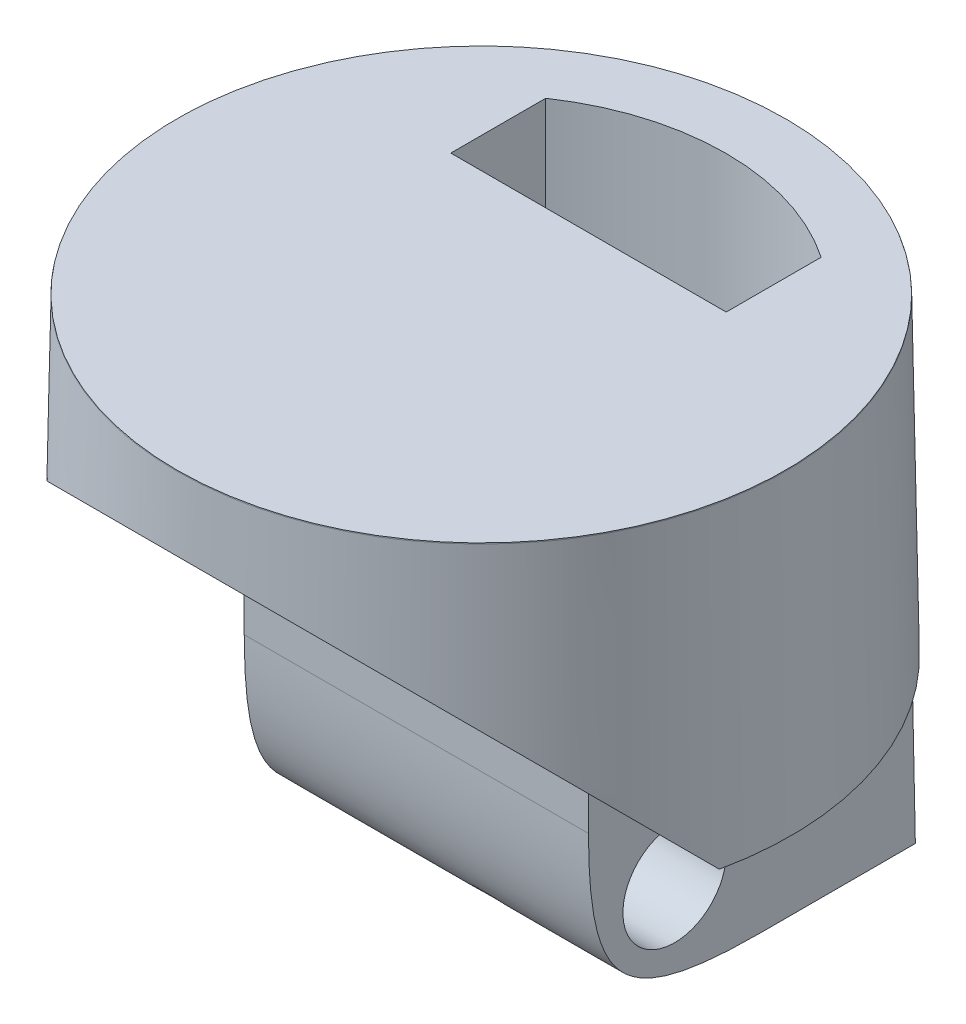
from build123d import *

# Parameters (mm, degrees)
SKETCH1_R                     = 9
BOSS_EXTRUDE1_DEPTH           = 19
BOSS_EXTRUDE1_TAPER           = 1
BOSS_EXTRUDE1_OTHER_WAY_DEPTH = 6
BOSS_EXTRUDE1_OTHER_WAY_TAPER = -1
CUT_EXTRUDE1_DEPTH            = 23.951954839
CUT_EXTRUDE1_DEPTH_BACK       = 23.951954839
SKETCH4_W                     = 6.502745185
SKETCH4_H                     = 6
CUT_EXTRUDE2_DEPTH            = 24.763281499
SKETCH5_R                     = 1.5
CUT_EXTRUDE3_DEPTH            = 26.296168166
FILLET1_SIZE                  = 5
CUT_EXTRUDE4_DEPTH            = 23.910611578
CUT_EXTRUDE4_DEPTH_BACK       = 23.910611578
SKETCH6_W                     = 24.694280634
SKETCH6_H                     = 10.883453579
CUT_EXTRUDE5_DEPTH            = 20.809242737


with BuildPart() as part:
    # Sketch1 → Boss-Extrude1 (new body)
    with BuildSketch(Plane(origin=(0, 0, 0), x_dir=(1, 0, 0), z_dir=(0, 1, 0))):
        Circle(SKETCH1_R)
    extrude(amount=BOSS_EXTRUDE1_DEPTH, taper=BOSS_EXTRUDE1_TAPER)

    # Sketch1 → Boss-Extrude1 other way (add)
    with BuildSketch(Plane(origin=(0, 0, 0), x_dir=(1, 0, 0), z_dir=(0, 1, 0))):
        Circle(SKETCH1_R)
    extrude(amount=-BOSS_EXTRUDE1_OTHER_WAY_DEPTH, taper=BOSS_EXTRUDE1_OTHER_WAY_TAPER)

    # Sketch3 → Cut-Extrude1 (cut, two sides: drawn at the far end of the back side and taken through both)
    with BuildSketch(Plane(origin=(0, 0, 0), x_dir=(0, 0, -1), z_dir=(1, 0, 0)).offset(-CUT_EXTRUDE1_DEPTH_BACK)):
        Polygon((-1.886057768, -6), (-1.886057768, 0), (-9.929766736, 8.043708969), (-9.929766736, -6), align=None)
    extrude(amount=CUT_EXTRUDE1_DEPTH + CUT_EXTRUDE1_DEPTH_BACK, mode=Mode.SUBTRACT)

    # Sketch4 → Cut-Extrude2 (cut, through all)
    with BuildSketch(Plane.XY.offset(1.886057768)):
        with Locations((-8.251372593, -3)):
            Rectangle(SKETCH4_W, SKETCH4_H)
        with Locations((8.251372593, -3)):
            Rectangle(SKETCH4_W, SKETCH4_H)
    extrude(amount=-CUT_EXTRUDE2_DEPTH, mode=Mode.SUBTRACT)

    # Sketch5 → Cut-Extrude3 (cut, through all)
    with BuildSketch(Plane(origin=(5, 0, 0), x_dir=(0, 0, -1), z_dir=(1, 0, 0))):
        with Locations((0.613942232, -3.5)):
            Circle(SKETCH5_R)
    extrude(amount=-CUT_EXTRUDE3_DEPTH, mode=Mode.SUBTRACT)

    # Fillet1
    # a fillet whose section is not a circle: 5 mm, written as the material it takes off along each edge
    with BuildSketch(Plane(origin=(17.5, -6, 1.886057768), x_dir=(0, 0, -1), z_dir=(-1, 0, 0))) as fillet1_piece_1:
        with BuildLine():
            Bezier((FILLET1_SIZE, 0), (0, 0), (0, -FILLET1_SIZE), weights=[1, 1.5, 1])
            Line((0, -FILLET1_SIZE), (0, 0))
            Line((0, 0), (FILLET1_SIZE, 0))
        make_face()
    extrude(amount=35, mode=Mode.SUBTRACT)

    # Fillet2
    # a fillet whose section is not a circle: 10, 5 mm, written as the material it takes off along each edge
    with BuildSketch(Plane(origin=(0, 19, 0), x_dir=(1, 0, 0), z_dir=(0, 0, -1))) as fillet2_piece_1:
        with BuildLine():
            Bezier((8.841381251, 9.912737968), (8.668353766, 0), (3.842142775, 0), weights=[1, 0.818181818, 1])
            Line((3.842142775, 0), (8.668353766, 0))
            Line((8.668353766, 0), (8.841381251, 9.912737968))
        make_face()
    revolve(axis=Axis((0, 19, 0), (0, -1, 0)), mode=Mode.SUBTRACT)

    # Sketch6 → Cut-Extrude4 (cut, two sides: drawn at the far end of the back side and taken through both)
    with BuildSketch(Plane(origin=(0, 0, 0), x_dir=(0, 0, -1), z_dir=(1, 0, 0)).offset(-CUT_EXTRUDE4_DEPTH_BACK)):
        with Locations((1.854254765, 14.558273211)):
            Rectangle(SKETCH6_W, SKETCH6_H)
    extrude(amount=CUT_EXTRUDE4_DEPTH + CUT_EXTRUDE4_DEPTH_BACK, mode=Mode.SUBTRACT)

    # Sketch7 → Cut-Extrude5 (cut, through all)
    with BuildSketch(Plane.XZ.offset(6)):
        with BuildLine():
            Line((4, -3.113942232), (4, -5.871728358))
            ThreePointArc((4, -5.871728358), (0, -7.10473039), (-4, -5.871728358))
            Line((-4, -5.871728358), (-4, -3.113942232))
            Line((-4, -3.113942232), (4, -3.113942232))
        make_face()
    extrude(amount=-CUT_EXTRUDE5_DEPTH, mode=Mode.SUBTRACT)


solid = part.part
